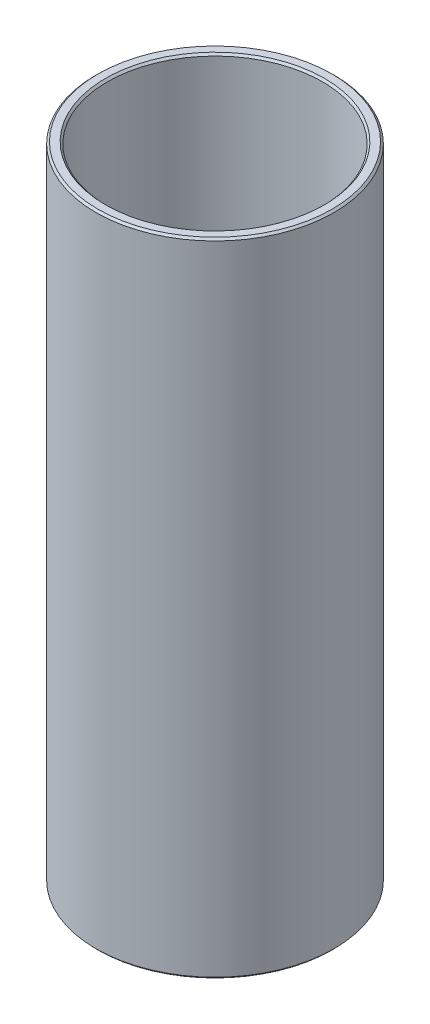
from build123d import *
from OCP.BRepFilletAPI import BRepFilletAPI_MakeChamfer

# Parameters (mm, degrees)
SKETCH1_R           = 50
BOSS_EXTRUDE1_DEPTH = 269.324814248
SKETCH2_R           = 45.18835864
CUT_EXTRUDE1_DEPTH  = 279.452609199
CHAMFER1_SIZE       = 0.798109197
CHAMFER1_SIZE2      = 0.84522854


with BuildPart() as part:
    # Sketch1 → Boss-Extrude1 (new body)
    with BuildSketch(Plane(origin=(0, 0, 0), x_dir=(1, 0, 0), z_dir=(0, 1, 0))):
        Circle(SKETCH1_R)
    extrude(amount=BOSS_EXTRUDE1_DEPTH)

    # Sketch2 → Cut-Extrude1 (cut, through all)
    with BuildSketch(Plane(origin=(0, 0, 0), x_dir=(1, 0, 0), z_dir=(0, 1, 0))):
        Circle(SKETCH2_R)
    extrude(amount=CUT_EXTRUDE1_DEPTH, mode=Mode.SUBTRACT)

    # Chamfer1: one chamfer whose edges measure the first distance from different faces: ONE call of the kernel's chamfer builder (chamfer() names one face for all edges)
    chamfer1_edges_1 = [part.edges().sort_by_distance(p)[0] for p in [
        (-45.18835864, 269.324814248, 0),
    ]]
    chamfer1_side_1 = [part.faces().sort_by_distance(p)[0] for p in [
        (-48.585786438, 269.324814248, 0),
    ]]
    chamfer1_edges_2 = [part.edges().sort_by_distance(p)[0] for p in [
        (-45.18835864, 0, 0),
    ]]
    chamfer1_side_2 = [part.faces().sort_by_distance(p)[0] for p in [
        (-45.18835864, 134.662407124, 0),
    ]]
    chamfer1_edges_3 = [part.edges().sort_by_distance(p)[0] for p in [
        (-50, 0, 0),
    ]]
    chamfer1_side_3 = [part.faces().sort_by_distance(p)[0] for p in [
        (-48.585786438, 0, 0),
    ]]
    chamfer1_edges_4 = [part.edges().sort_by_distance(p)[0] for p in [
        (-50, 269.324814248, 0),
    ]]
    chamfer1_side_4 = [part.faces().sort_by_distance(p)[0] for p in [
        (-50, 134.662407124, 0),
    ]]
    chamfer1 = BRepFilletAPI_MakeChamfer(part.part.solid().wrapped)
    for e in chamfer1_edges_1:
        chamfer1.Add(CHAMFER1_SIZE, CHAMFER1_SIZE2, e.wrapped, chamfer1_side_1[0].wrapped)  # the first distance lies on this face
    for e in chamfer1_edges_2:
        chamfer1.Add(CHAMFER1_SIZE, CHAMFER1_SIZE2, e.wrapped, chamfer1_side_2[0].wrapped)  # the first distance lies on this face
    for e in chamfer1_edges_3:
        chamfer1.Add(CHAMFER1_SIZE, CHAMFER1_SIZE2, e.wrapped, chamfer1_side_3[0].wrapped)  # the first distance lies on this face
    for e in chamfer1_edges_4:
        chamfer1.Add(CHAMFER1_SIZE, CHAMFER1_SIZE2, e.wrapped, chamfer1_side_4[0].wrapped)  # the first distance lies on this face
    add(Compound.cast(chamfer1.Shape()), mode=Mode.REPLACE)


solid = part.part
